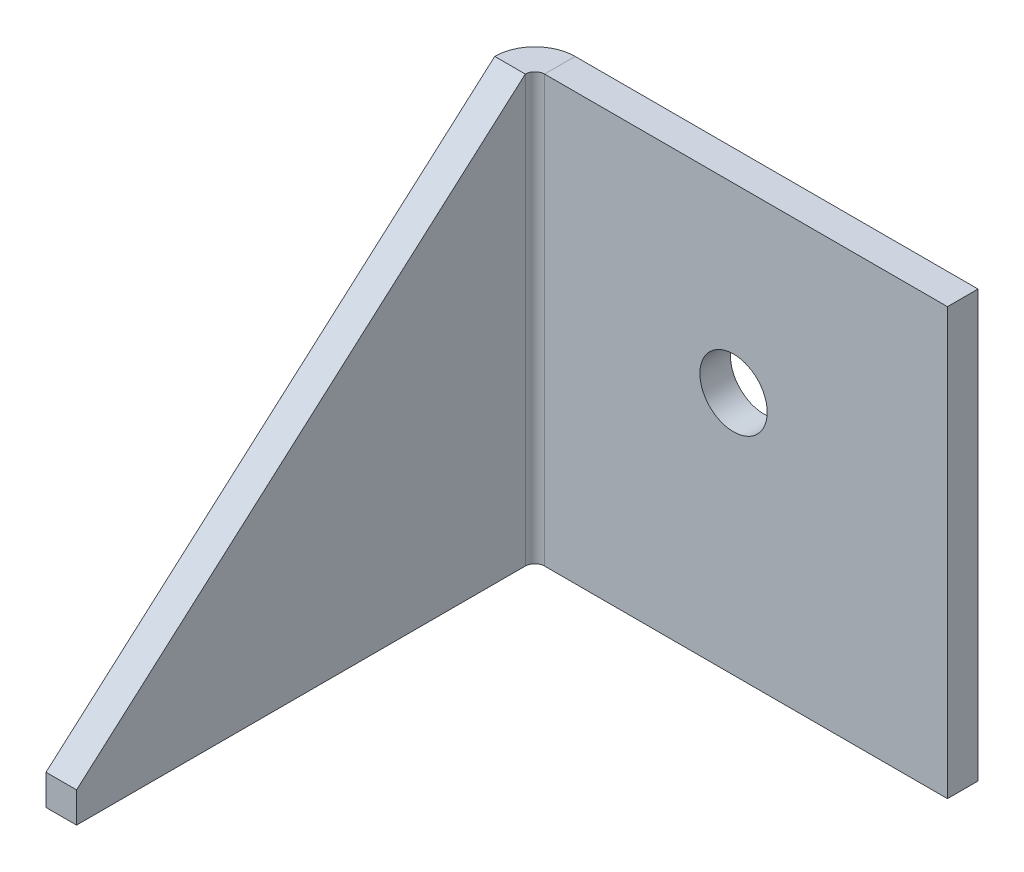
from build123d import *

# Parameters (mm, degrees)
SKETCH1_W                    = 42.8625
SKETCH1_H                    = 44.27474
SKETCH1_R                    = 3
BASE_FLANGE1_DEPTH           = 3.175
EDGE_FLANGE1_STRIP_W         = 14.7
EDGE_FLANGE1_STRIP_H         = 3.175
EDGE_FLANGE1_STRIP_CUT_DEPTH = 44.27474
EDGE_FLANGE1_DEPTH           = 44.27474
CUT_EXTRUDE1_DEPTH           = 73.0427273
CUT_EXTRUDE1_DEPTH_BACK      = 3.175
M6_CLEARANCE_HOLE6_D         = 7


# Sheet-metal steps are written as plain solids
with BuildPart() as part:
    # Sketch1 → Base-Flange1 (new body)
    with BuildSketch(Plane.XY):
        Rectangle(SKETCH1_W, SKETCH1_H)
        with Locations((-0.79375, 3.26263)):
            Circle(SKETCH1_R, mode=Mode.SUBTRACT)
    extrude(amount=BASE_FLANGE1_DEPTH)

    # Edge-Flange1 strip (across the edge) → Edge-Flange1 strip cut (cut)
    with BuildSketch(Plane(origin=(-21.43125, 22.13737, 3.175), x_dir=(1, 0, 0), z_dir=(0, -1, 0))):
        with Locations((-6.35, -1.5875)):
            Rectangle(EDGE_FLANGE1_STRIP_W, EDGE_FLANGE1_STRIP_H)
    extrude(amount=EDGE_FLANGE1_STRIP_CUT_DEPTH, mode=Mode.SUBTRACT)

    # Edge-Flange1 section (across the edge) → Edge-Flange1 (add)
    with BuildSketch(Plane(origin=(-21.43125, 22.13737, 3.175), x_dir=(1, 0, 0), z_dir=(0, -1, 0))):
        with BuildLine():
            Line((-3.175, 1), (-3.175, 47.625))
            Line((-3.175, 47.625), (0, 47.625))
            Line((0, 47.625), (0, 1))
            ThreePointArc((0, 1), (0.292893219, 0.292893219), (1, 0))
            Line((1, 0), (1, -3.175))
            ThreePointArc((1, -3.175), (-1.952170811, -1.952170811), (-3.175, 1))
        make_face()
    extrude(amount=EDGE_FLANGE1_DEPTH)

    # Sketch10 → Cut-Extrude1 (cut, two sides: drawn at the far end of the back side and taken through both)
    with BuildSketch(Plane.ZY.offset(24.60625).offset(-CUT_EXTRUDE1_DEPTH_BACK)):
        Polygon((4.175, 22.13737), (50.8, -18.96237), (50.8, 22.13737), align=None)
    extrude(amount=CUT_EXTRUDE1_DEPTH + CUT_EXTRUDE1_DEPTH_BACK, mode=Mode.SUBTRACT)

    # M6 Clearance Hole6 (through all)
    with Locations(Plane.XY.offset(3.175)):
        with Locations((-0.79375, 3.26263)):
            Hole(M6_CLEARANCE_HOLE6_D / 2)


solid = part.part
